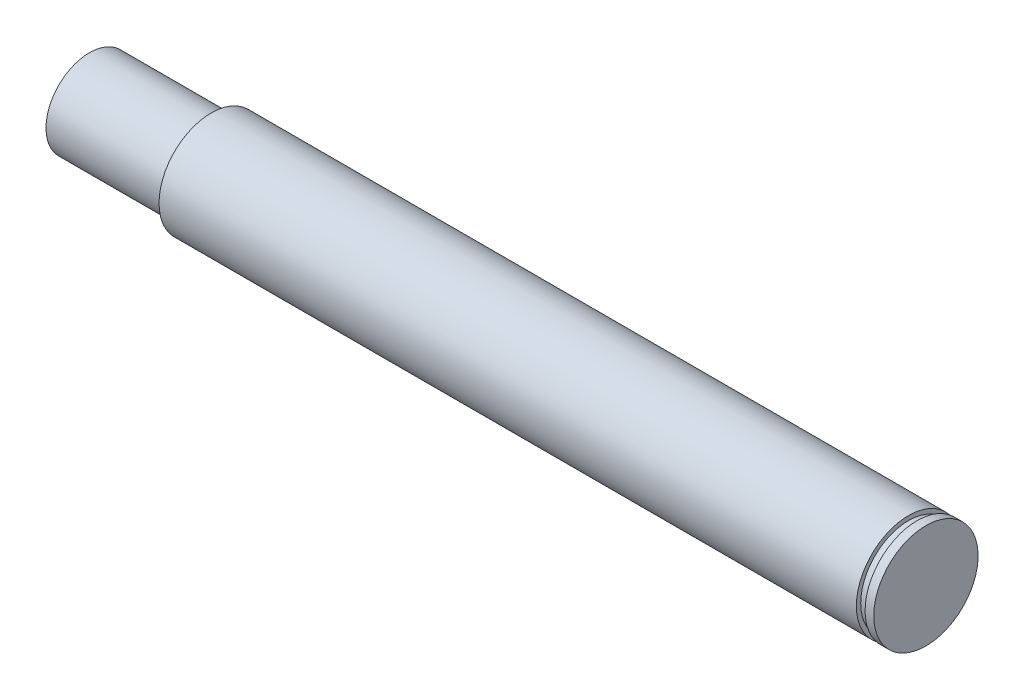
from build123d import *


with BuildPart() as part:
    # ｽｹｯﾁ2 → 回転1 (revolve)
    with BuildSketch(Plane.XY):
        Polygon((14, 5), (0, 5), (0, 0), (96.2, 0), (96.2, 6), (95.2, 6), (95.2, 5.5), (94.2, 5.5), (94.2, 6), (14, 6), align=None)
    revolve(axis=Axis((0, 0, 0), (1, 0, 0)))


solid = part.part
